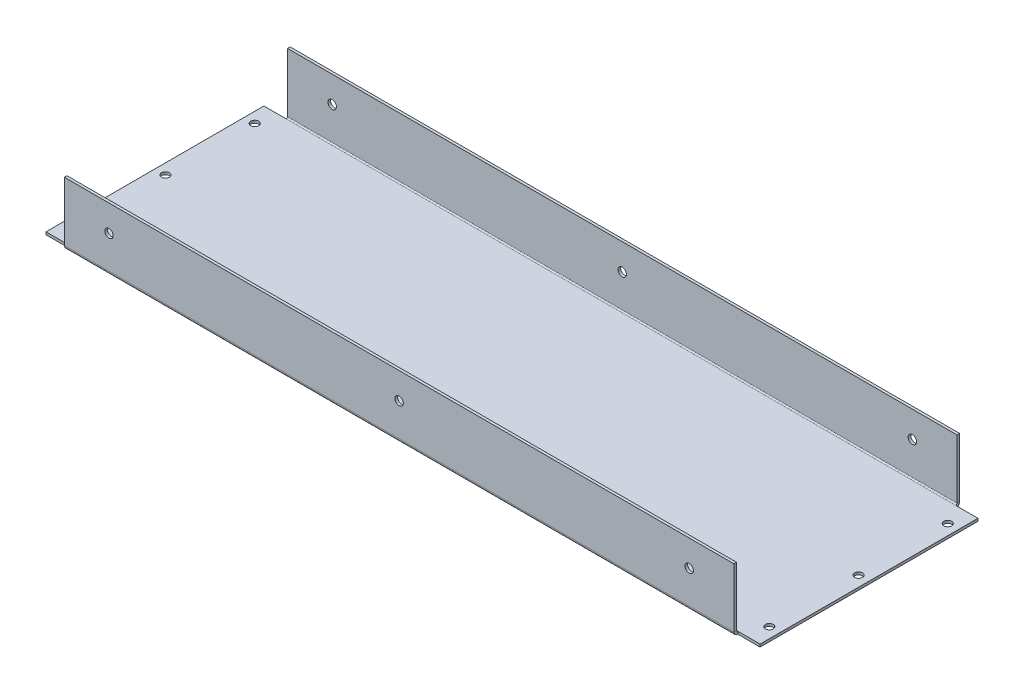
from build123d import *

# Parameters (mm, degrees)
SKETCH1_W                      = 272
SKETCH1_H                      = 84
BASE_FLANGE1_DEPTH             = 1
EDGE_FLANGE1_STRIP_W           = 5
EDGE_FLANGE1_STRIP_H           = 1
EDGE_FLANGE1_STRIP_CUT_DEPTH   = 272
EDGE_FLANGE1_STRIP_2_W         = 5
EDGE_FLANGE1_STRIP_2_H         = 1
EDGE_FLANGE1_STRIP_CUT_2_DEPTH = 272
EDGE_FLANGE1_DEPTH             = 272
EDGE_FLANGE1_BEND_DEPTH        = 272
CUT_EXTRUDE1_START             = -78.427547771
CUT_EXTRUDE1_DEPTH             = 8.5
CUT_EXTRUDE1_START_2           = 185.072452229
CUT_EXTRUDE1_2_DEPTH           = 8.5
SKETCH13_R                     = 1.6
CUT_EXTRUDE2_DEPTH             = 100
SKETCH14_R                     = 1.5
CUT_EXTRUDE3_DEPTH             = 100


# Read off the part's stored shape, not the designer's step: Cut-Extrude1
# Sheet-metal steps are written as plain solids
with BuildPart() as part:
    # Sketch1 → Base-Flange1 (new body)
    with BuildSketch(Plane(origin=(0, 0, 0), x_dir=(1, 0, 0), z_dir=(0, 1, 0))):
        with Locations((57.572452229, -1.800955414)):
            Rectangle(SKETCH1_W, SKETCH1_H)
    extrude(amount=-BASE_FLANGE1_DEPTH)

    # Edge-Flange1 strip (across the edge) → Edge-Flange1 strip cut (cut)
    with BuildSketch(Plane(origin=(-78.427547771, 0, 43.800955414), x_dir=(0, 0, -1), z_dir=(1, 0, 0))):
        with Locations((-2, -0.5)):
            Rectangle(EDGE_FLANGE1_STRIP_W, EDGE_FLANGE1_STRIP_H)
    extrude(amount=EDGE_FLANGE1_STRIP_CUT_DEPTH, mode=Mode.SUBTRACT)

    # Edge-Flange1 strip 2 (across the edge) → Edge-Flange1 strip cut 2 (cut)
    with BuildSketch(Plane(origin=(193.572452229, 0, -40.199044586), x_dir=(0, 0, 1), z_dir=(-1, 0, 0))):
        with Locations((-2, -0.5)):
            Rectangle(EDGE_FLANGE1_STRIP_2_W, EDGE_FLANGE1_STRIP_2_H)
    extrude(amount=EDGE_FLANGE1_STRIP_CUT_2_DEPTH, mode=Mode.SUBTRACT)

    # Edge-Flange1 section (across the edge) → Edge-Flange1 (add)
    with BuildSketch(Plane(origin=(-78.427547771, 0, 43.800955414), x_dir=(0, 0, -1), z_dir=(1, 0, 0))):
        with BuildLine():
            Line((-1, 0.5), (-1, 23))
            Line((-1, 23), (0, 23))
            Line((0, 23), (0, 0.5))
            ThreePointArc((0, 0.5), (0.146446609, 0.146446609), (0.5, 0))
            Line((0.5, 0), (0.5, -1))
            ThreePointArc((0.5, -1), (-0.560660172, -0.560660172), (-1, 0.5))
        make_face()
    extrude(amount=EDGE_FLANGE1_DEPTH)

    # Edge-Flange1 section 2 (across the edge) → Edge-Flange1 bend (add)
    with BuildSketch(Plane(origin=(193.572452229, 0, -40.199044586), x_dir=(0, 0, 1), z_dir=(-1, 0, 0))):
        with BuildLine():
            Line((-1, 0.5), (-1, 23))
            Line((-1, 23), (0, 23))
            Line((0, 23), (0, 0.5))
            ThreePointArc((0, 0.5), (0.146446609, 0.146446609), (0.5, 0))
            Line((0.5, 0), (0.5, -1))
            ThreePointArc((0.5, -1), (-0.560660172, -0.560660172), (-1, 0.5))
        make_face()
    extrude(amount=EDGE_FLANGE1_BEND_DEPTH)

    # Cut-Extrude1 outline → Cut-Extrude1 (cut)
    with BuildSketch(Plane.YZ.offset(CUT_EXTRUDE1_START)):
        with BuildLine():
            ThreePointArc((0.5, -40.199044586), (0.146446609, -40.052597977), (0, -39.699044586))
            Line((0, -39.699044586), (-1, -39.699044586))
            ThreePointArc((-1, -39.699044586), (-0.560660172, -40.759704758), (0.5, -41.199044586))
            Line((0.5, -41.199044586), (23, -41.199044586))
            Line((23, -41.199044586), (23, -40.199044586))
            Line((23, -40.199044586), (0.5, -40.199044586))
        make_face()
        with BuildLine():
            ThreePointArc((0.5, 44.800955414), (-0.560660172, 44.361615586), (-1, 43.300955414))
            Line((-1, 43.300955414), (0, 43.300955414))
            ThreePointArc((0, 43.300955414), (0.146446609, 43.654508805), (0.5, 43.800955414))
            Line((0.5, 43.800955414), (23, 43.800955414))
            Line((23, 43.800955414), (23, 44.800955414))
            Line((23, 44.800955414), (0.5, 44.800955414))
        make_face()
    extrude(amount=CUT_EXTRUDE1_DEPTH, mode=Mode.SUBTRACT)

    # Cut-Extrude1 2 outline → Cut-Extrude1 2 (cut)
    with BuildSketch(Plane.YZ.offset(CUT_EXTRUDE1_START_2)):
        with BuildLine():
            ThreePointArc((0.5, -40.199044586), (0.146446609, -40.052597977), (0, -39.699044586))
            Line((0, -39.699044586), (-1, -39.699044586))
            ThreePointArc((-1, -39.699044586), (-0.560660172, -40.759704758), (0.5, -41.199044586))
            Line((0.5, -41.199044586), (23, -41.199044586))
            Line((23, -41.199044586), (23, -40.199044586))
            Line((23, -40.199044586), (0.5, -40.199044586))
        make_face()
        with BuildLine():
            ThreePointArc((0.5, 44.800955414), (-0.560660172, 44.361615586), (-1, 43.300955414))
            Line((-1, 43.300955414), (0, 43.300955414))
            ThreePointArc((0, 43.300955414), (0.146446609, 43.654508805), (0.5, 43.800955414))
            Line((0.5, 43.800955414), (23, 43.800955414))
            Line((23, 43.800955414), (23, 44.800955414))
            Line((23, 44.800955414), (0.5, 44.800955414))
        make_face()
    extrude(amount=CUT_EXTRUDE1_2_DEPTH, mode=Mode.SUBTRACT)

    # Sketch13 → Cut-Extrude2 (cut)
    with BuildSketch(Plane(origin=(0, 0, -41.199044586), x_dir=(-1, 0, 0), z_dir=(0, 0, -1))):
        with Locations(Location((-168.072452229, 13, 0), (0, 0, 90))):
            Circle(SKETCH13_R)
        with Locations(Location((-57.572452229, 13, 0), (0, 0, 90))):
            Circle(SKETCH13_R)
        with Locations(Location((52.927547771, 13, 0), (0, 0, 90))):
            Circle(SKETCH13_R)
    extrude(amount=-CUT_EXTRUDE2_DEPTH, mode=Mode.SUBTRACT)

    # Sketch14 → Cut-Extrude3 (cut)
    with BuildSketch(Plane(origin=(0, 0, 0), x_dir=(1, 0, 0), z_dir=(0, 1, 0))):
        with Locations(Location((-74.427547771, -1.800955414, 0), (0, 0, 270))):
            Circle(SKETCH14_R)
        with Locations(Location((-74.427547771, 32.199044586, 0), (0, 0, 270))):
            Circle(SKETCH14_R)
        with Locations(Location((-74.427547771, -35.800955414, 0), (0, 0, 270))):
            Circle(SKETCH14_R)
        with Locations(Location((189.572452229, -35.800955414, 0), (0, 0, 270))):
            Circle(SKETCH14_R)
        with Locations(Location((189.572452229, -1.800955414, 0), (0, 0, 270))):
            Circle(SKETCH14_R)
        with Locations(Location((189.572452229, 32.199044586, 0), (0, 0, 270))):
            Circle(SKETCH14_R)
    extrude(amount=-CUT_EXTRUDE3_DEPTH, mode=Mode.SUBTRACT)


solid = part.part
